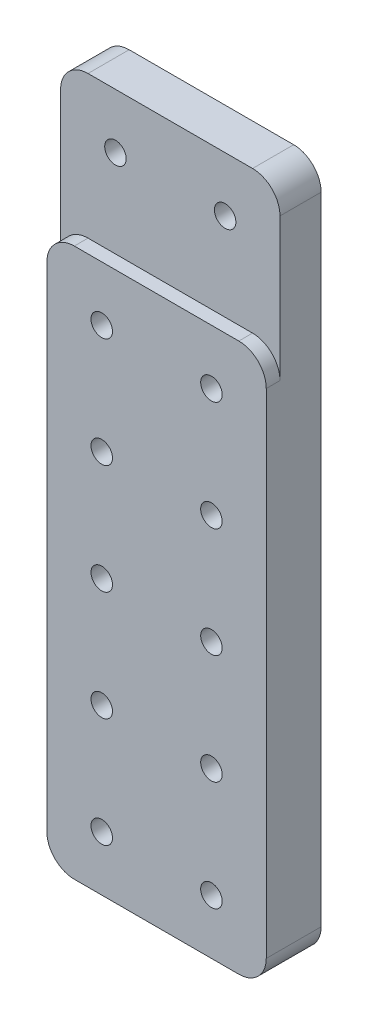
from build123d import *

# Parameters (mm, degrees)
SKETCH2_W           = 50.8
SKETCH2_H           = 160.02
BOSS_EXTRUDE1_DEPTH = 12.7
SKETCH3_R           = 2.4892
CUT_EXTRUDE1_DEPTH  = 169.369624339
FILLET1_R           = 6.35
SKETCH4_W           = 3.175
SKETCH4_H           = 33.02
CUT_EXTRUDE2_DEPTH  = 169.369624339
FILLET3_R           = 6.35


with BuildPart() as part:
    # Sketch2 → Boss-Extrude1 (new body)
    with BuildSketch(Plane.XY):
        with Locations((25.4, 80.01)):
            Rectangle(SKETCH2_W, SKETCH2_H)
    extrude(amount=-BOSS_EXTRUDE1_DEPTH)

    # Sketch3 → Cut-Extrude1 (cut, through all)
    with BuildSketch(Plane.XY):
        with Locations((12.7, 147.32)):
            Circle(SKETCH3_R)
        with Locations((38.1, 147.32)):
            Circle(SKETCH3_R)
        with Locations((12.7, 114.3)):
            Circle(SKETCH3_R)
        with Locations((12.7, 88.9)):
            Circle(SKETCH3_R)
        with Locations((12.7, 63.5)):
            Circle(SKETCH3_R)
        with Locations((12.7, 38.1)):
            Circle(SKETCH3_R)
        with Locations((12.7, 12.7)):
            Circle(SKETCH3_R)
        with Locations((38.1, 88.9)):
            Circle(SKETCH3_R)
        with Locations((38.1, 63.5)):
            Circle(SKETCH3_R)
        with Locations((38.1, 38.1)):
            Circle(SKETCH3_R)
        with Locations((38.1, 12.7)):
            Circle(SKETCH3_R)
        with Locations((38.1, 114.3)):
            Circle(SKETCH3_R)
    extrude(amount=-CUT_EXTRUDE1_DEPTH, mode=Mode.SUBTRACT)

    # Fillet1
    fillet1_edges = [part.edges().sort_by_distance(p)[0] for p in [
        (0, 0, -6.35),
        (50.8, 0, -6.35),
        (50.8, 160.02, -6.35),
        (0, 160.02, -6.35),
    ]]
    fillet(fillet1_edges, radius=FILLET1_R)

    # Sketch4 → Cut-Extrude2 (cut, through all)
    with BuildSketch(Plane.ZY):
        with Locations((-1.5875, 143.51)):
            Rectangle(SKETCH4_W, SKETCH4_H)
    extrude(amount=-CUT_EXTRUDE2_DEPTH, mode=Mode.SUBTRACT)

    # Fillet3
    fillet3_edges = [part.edges().sort_by_distance(p)[0] for p in [
        (50.8, 127, -1.5875),
        (0, 127, -1.5875),
    ]]
    fillet(fillet3_edges, radius=FILLET3_R)


solid = part.part
